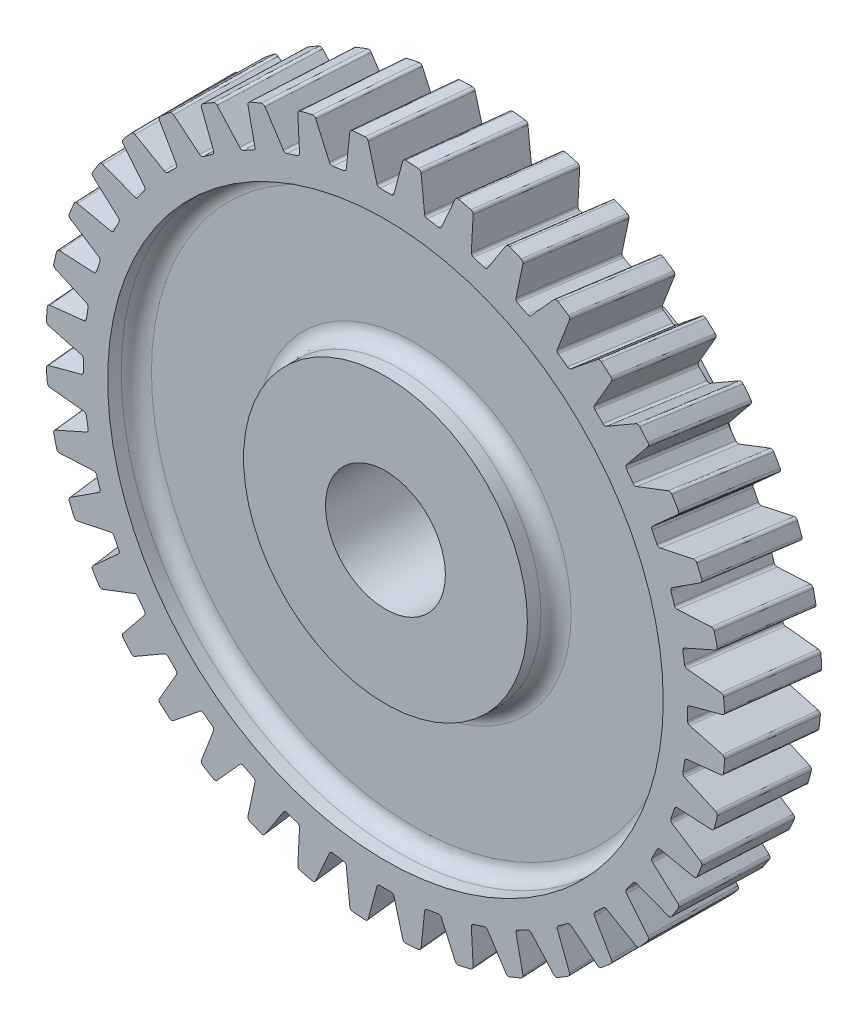
from build123d import *

# Parameters (mm, degrees)
FILLET1_R          = 1
CIRPATTERN1_COUNT  = 40
FILLET2_R          = 0.2
SKETCH7_R          = 1.25
CUT_EXTRUDE1_DEPTH = 41.543934121


with BuildPart() as part:
    # Sketch2 → Revolve1 (revolve)
    with BuildSketch(Plane(origin=(0, 0, 0), x_dir=(0, 0, -1), z_dir=(1, 0, 0))):
        Polygon((11, 3.96875), (-3.2, 3.96875), (-3.2, 9.4), (-1.3, 9.4), (-1.3, 18.4), (-3.2, 18.4), (-3.2, 22.5), (3.2, 22.5), (3.2, 18.4), (1.3, 18.4), (1.3, 9.4), (3.2, 9.4), (11, 9.4), align=None)
    revolve(axis=Axis((0, 0, 0), (0, 0, -1)))

    # Fillet1
    fillet1_edges = [part.edges().sort_by_distance(p)[0] for p in [
        (0, -18.4, 1.3),
        (0, -9.4, 1.3),
        (0, -9.4, -1.3),
        (0, -18.4, -1.3),
    ]]
    fillet(fillet1_edges, radius=FILLET1_R)

    # Cut-Sweep1: sweep along a path in Sketch4
    with BuildLine(Plane(origin=(0, 0, 0), x_dir=(1, 0, 0), z_dir=(0, 1, 0))) as cut_sweep1_path:
        Line((0, -3.2), (0.690971205, 3.2))
    # Sketch3 → Cut-Sweep1 (sweep, cut)
    with BuildSketch(Plane.XY.offset(3.2)):
        Polygon((-0.525, 20), (0.525, 20), (1.246362285, 22.6921607), (-1.246362285, 22.6921607), align=None)
    cut_sweep1 = sweep(path=cut_sweep1_path.line, mode=Mode.SUBTRACT)

    # CirPattern1: Cut-Sweep1 ×40 about axis
    cirpattern1_axis = Axis((0, 0, 3.2), (0, 0, 1))
    for i in range(1, CIRPATTERN1_COUNT):
        add(cut_sweep1.rotate(cirpattern1_axis, i * 360 / CIRPATTERN1_COUNT), mode=Mode.SUBTRACT)

    # Fillet2
    fillet2_edges = [part.edges().sort_by_distance(p)[0] for p in [
        (1.526462518, 22.448160552, 5.3054e-05),
        (0.870485603, 20, 0),
        (-0.845126217, 22.484122435, -6.2808e-05),
        (-2.003996756, 22.410577793, 5.3054e-05),
        (-2.26892082, 19.889940761, 0),
        (-3.305993578, 19.725684573, 0),
        (-4.352012976, 22.07509871, -6.2808e-05),
        (-5.485110979, 21.821172231, 5.3054e-05),
        (-5.352458883, 19.29012517, 0),
        (-6.351068225, 18.965657326, 0),
        (-7.751738732, 21.122512792, -6.2808e-05),
        (-8.831163565, 20.694456989, 5.3054e-05),
        (-8.304201644, 18.215322678, 0),
        (-9.239758494, 17.738632653, 0),
        (-10.960590953, 19.649820507, -6.2808e-05),
        (-11.959763596, 19.058175535, 5.3054e-05),
        (-11.0514674, 16.691998487, 0),
        (-11.900935244, 16.074823972, 0),
        (-13.89955705, 17.693284427, -6.2808e-05),
        (-14.793874554, 16.952618549, 5.3054e-05),
        (-13.526609351, 14.757661896, 0),
        (-14.269071471, 14.015199776, 0),
        (-16.496269922, 15.301080964, -6.2808e-05),
        (-17.263711223, 14.429631832, 5.3054e-05),
        (-15.668681288, 12.459942692, 0),
        (-16.285855803, 11.610474848, 0),
        (-18.68678988, 12.532114106, -6.2808e-05),
        (-19.308458027, 11.55133969, 5.3054e-05),
        (-17.42493829, 9.855418346, 0),
        (-17.901628315, 8.919861496, 0),
        (-20.417179054, 9.454565008, -6.2808e-05),
        (-20.877766513, 8.388615227, 5.3054e-05),
        (-18.752135481, 7.008220892, 0),
        (-19.076603325, 6.00961155, 0),
        (-21.644829518, 6.144213141, -6.2808e-05),
        (-21.932995098, 5.019335218, 5.3054e-05),
        (-19.617592862, 3.988457781, 0),
        (-19.781849051, 2.951385024, 0),
        (-22.339512445, 2.682570354, -6.2808e-05),
        (-22.448160552, 1.526462518, 5.3054e-05),
        (-20, 0.870485603, 0),
        (-20, -0.179514397, 0),
        (-22.484122435, -0.845126217, -6.2808e-05),
        (-22.410577793, -2.003996756, 5.3054e-05),
        (-19.889940761, -2.26892082, 0),
        (-19.725684573, -3.305993578, 0),
        (-22.07509871, -4.352012976, -6.2808e-05),
        (-21.821172231, -5.485110979, 5.3054e-05),
        (-19.29012517, -5.352458883, 0),
        (-18.965657326, -6.351068225, 0),
        (-21.122512792, -7.751738732, -6.2808e-05),
        (-20.694456989, -8.831163565, 5.3054e-05),
        (-18.215322678, -8.304201644, 0),
        (-17.738632653, -9.239758494, 0),
        (-19.649820507, -10.960590953, -6.2808e-05),
        (-19.058175535, -11.959763596, 5.3054e-05),
        (-16.691998487, -11.0514674, 0),
        (-16.074823972, -11.900935244, 0),
        (-17.693284427, -13.89955705, -6.2808e-05),
        (-16.952618549, -14.793874554, 5.3054e-05),
        (-14.757661896, -13.526609351, 0),
        (-14.015199776, -14.269071471, 0),
        (-15.301080964, -16.496269922, -6.2808e-05),
        (-14.429631832, -17.263711223, 5.3054e-05),
        (-12.459942692, -15.668681288, 0),
        (-11.610474848, -16.285855803, 0),
        (-12.532114106, -18.68678988, -6.2808e-05),
        (-11.55133969, -19.308458027, 5.3054e-05),
        (-9.855418346, -17.42493829, 0),
        (-8.919861496, -17.901628315, 0),
        (-9.454565008, -20.417179054, -6.2808e-05),
        (-8.388615227, -20.877766513, 5.3054e-05),
        (-7.008220892, -18.752135481, 0),
        (-6.00961155, -19.076603325, 0),
        (-6.144213141, -21.644829518, -6.2808e-05),
        (-5.019335218, -21.932995098, 5.3054e-05),
        (-3.988457781, -19.617592862, 0),
        (-2.951385024, -19.781849051, 0),
        (-2.682570354, -22.339512445, -6.2808e-05),
        (-1.526462518, -22.448160552, 5.3054e-05),
        (-0.870485603, -20, 0),
        (0.179514397, -20, 0),
        (0.845126217, -22.484122435, -6.2808e-05),
        (2.003996756, -22.410577793, 5.3054e-05),
        (2.26892082, -19.889940761, 0),
        (3.305993578, -19.725684573, 0),
        (4.352012976, -22.07509871, -6.2808e-05),
        (5.485110979, -21.821172231, 5.3054e-05),
        (5.352458883, -19.29012517, 0),
        (6.351068225, -18.965657326, 0),
        (7.751738732, -21.122512792, -6.2808e-05),
        (8.831163565, -20.694456989, 5.3054e-05),
        (8.304201644, -18.215322678, 0),
        (9.239758494, -17.738632653, 0),
        (10.960590953, -19.649820507, -6.2808e-05),
        (11.959763596, -19.058175535, 5.3054e-05),
        (11.0514674, -16.691998487, 0),
        (11.900935244, -16.074823972, 0),
        (13.89955705, -17.693284427, -6.2808e-05),
        (14.793874554, -16.952618549, 5.3054e-05),
        (13.526609351, -14.757661896, 0),
        (14.269071471, -14.015199776, 0),
        (16.496269922, -15.301080964, -6.2808e-05),
        (17.263711223, -14.429631832, 5.3054e-05),
        (15.668681288, -12.459942692, 0),
        (16.285855803, -11.610474848, 0),
        (18.68678988, -12.532114106, -6.2808e-05),
        (19.308458027, -11.55133969, 5.3054e-05),
        (17.42493829, -9.855418346, 0),
        (17.901628315, -8.919861496, 0),
        (20.417179054, -9.454565008, -6.2808e-05),
        (20.877766513, -8.388615227, 5.3054e-05),
        (18.752135481, -7.008220892, 0),
        (19.076603325, -6.00961155, 0),
        (21.644829518, -6.144213141, -6.2808e-05),
        (21.932995098, -5.019335218, 5.3054e-05),
        (19.617592862, -3.988457781, 0),
        (19.781849051, -2.951385024, 0),
        (22.339512445, -2.682570354, -6.2808e-05),
        (22.448160552, -1.526462518, 5.3054e-05),
        (20, -0.870485603, 0),
        (20, 0.179514397, 0),
        (22.484122435, 0.845126217, -6.2808e-05),
        (22.410577793, 2.003996756, 5.3054e-05),
        (19.889940761, 2.26892082, 0),
        (19.725684573, 3.305993578, 0),
        (22.07509871, 4.352012976, -6.2808e-05),
        (21.821172231, 5.485110979, 5.3054e-05),
        (19.29012517, 5.352458883, 0),
        (18.965657326, 6.351068225, 0),
        (21.122512792, 7.751738732, -6.2808e-05),
        (20.694456989, 8.831163565, 5.3054e-05),
        (18.215322678, 8.304201644, 0),
        (17.738632653, 9.239758494, 0),
        (19.649820507, 10.960590953, -6.2808e-05),
        (19.058175535, 11.959763596, 5.3054e-05),
        (16.691998487, 11.0514674, 0),
        (16.074823972, 11.900935244, 0),
        (17.693284427, 13.89955705, -6.2808e-05),
        (16.952618549, 14.793874554, 5.3054e-05),
        (14.757661896, 13.526609351, 0),
        (14.015199776, 14.269071471, 0),
        (15.301080964, 16.496269922, -6.2808e-05),
        (14.429631832, 17.263711223, 5.3054e-05),
        (12.459942692, 15.668681288, 0),
        (11.610474848, 16.285855803, 0),
        (12.532114106, 18.68678988, -6.2808e-05),
        (11.55133969, 19.308458027, 5.3054e-05),
        (9.855418346, 17.42493829, 0),
        (8.919861496, 17.901628315, 0),
        (9.454565008, 20.417179054, -6.2808e-05),
        (8.388615227, 20.877766513, 5.3054e-05),
        (7.008220892, 18.752135481, 0),
        (6.00961155, 19.076603325, 0),
        (6.144213141, 21.644829518, -6.2808e-05),
        (5.019335218, 21.932995098, 5.3054e-05),
        (3.988457781, 19.617592862, 0),
        (2.951385024, 19.781849051, 0),
        (2.682570354, 22.339512445, -6.2808e-05),
        (-0.179514397, 20, 0),
    ]]
    fillet(fillet2_edges, radius=FILLET2_R)

    # Sketch7 → Cut-Extrude1 (cut, through all)
    with BuildSketch(Plane(origin=(9.4, 0, 0), x_dir=(0, 0, -1), z_dir=(1, 0, 0))):
        with Locations((7, 0)):
            Circle(SKETCH7_R)
    extrude(amount=-CUT_EXTRUDE1_DEPTH, mode=Mode.SUBTRACT)


solid = part.part
